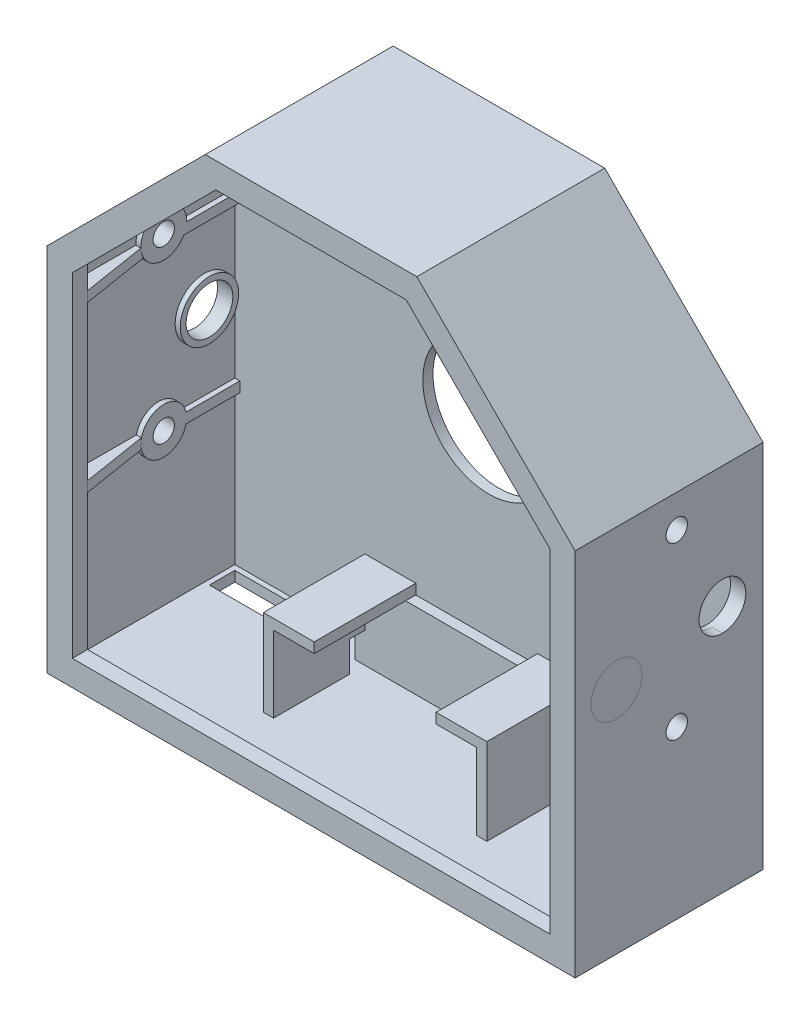
from build123d import *

# Parameters (mm, degrees)
BOSS_EXTRU_1_DEPTH       = 35
COQUE3_T                 = 2
ESQUISSE3_R              = 13
ENL_V_MAT_EXTRU_1_DEPTH  = 82.443231763
ESQUISSE5_W              = 20
ESQUISSE5_H              = 5
ENL_V_MAT_EXTRU_3_DEPTH  = 2
ESQUISSE6_R              = 4.6
ENL_V_MAT_EXTRU_4_DEPTH  = 122.428991596
ESQUISSE7_R              = 2.1
ENL_V_MAT_EXTRU_5_DEPTH  = 122.428991596
ESQUISSE8_W              = 44
ESQUISSE8_H              = 20
BOSS_EXTRU_2_DEPTH       = 17
ESQUISSE9_W              = 40
ESQUISSE9_H              = 15
ENL_V_MAT_EXTRU_7_DEPTH  = 18
ESQUISSE10_W             = 3
ESQUISSE10_H             = 6
ENL_V_MAT_EXTRU_8_DEPTH  = 5
BOSS_EXTRU_4_DEPTH       = 3
ESQUISSE22_R             = 4.5
BOSS_EXTRU_7_DEPTH       = 1
ENL_V_START              = -3
ESQUISSE24_R             = 2.1
ENL_V_MAT_EXTRU_12_DEPTH = 3
ESQUISSE20_R             = 4.5
BOSS_EXTRU_8_DEPTH       = 1
ESQUISSE25_R             = 2.1
ENL_V_MAT_EXTRU_13_DEPTH = 3
BOSS_EXTRU_9_START       = 1
ESQUISSE26_R             = 4.5
BOSS_EXTRU_9_DEPTH       = 1
ESQUISSE27_R             = 2.1
ENL_V_MAT_EXTRU_14_DEPTH = 3
BOSS_EXTRU_10_START      = 1
ESQUISSE28_R             = 4.5
BOSS_EXTRU_10_DEPTH      = 1
ESQUISSE29_R             = 2.1
ENL_V_MAT_EXTRU_15_DEPTH = 3
ESQUISSE34_R             = 5.75
BOSS_EXTRU_16_DEPTH      = 1
ESQUISSE35_R             = 4.6
ENL_V_MAT_EXTRU_19_DEPTH = 1
ESQUISSE36_R             = 5.5
BOSS_EXTRU_17_DEPTH      = 1
ESQUISSE37_R             = 4.6
ENL_V_MAT_EXTRU_20_DEPTH = 1
NERVURE3_REACH           = 96.86
ESQUISSE38_WALL_W        = 204.379203954
ESQUISSE38_WALL_H        = 2
NERVURE4_REACH           = 120.87
ESQUISSE39_WALLS_W       = 252.639353074
ESQUISSE39_WALLS_H       = 2
ESQUISSE40_W             = 24
ESQUISSE40_H             = 20
ENL_V_MAT_EXTRU_21_DEPTH = 2
SYM_TRIE2_START          = 12.2
SYM_TRIE2_OUTLINE_W      = 1
SYM_TRIE2_OUTLINE_H      = 11.067979308
SYM_TRIE2_DEPTH          = 2


with BuildPart() as part:
    # Esquisse1 → Boss.-Extru.1 (new body)
    with BuildSketch(Plane.XY):
        Polygon((-50, 20), (-20, 50), (20, 50), (50, 20), (50, -50), (-50, -50), align=None)
    extrude(amount=BOSS_EXTRU_1_DEPTH)

    # Coque3
    coque3_openings = [part.faces().sort_by_distance(p)[0] for p in [
        (0, -3.956043956, 35),
    ]]
    offset(amount=COQUE3_T, openings=coque3_openings, kind=Kind.INTERSECTION)

    # Esquisse3 → Enlèv. mat.-Extru.1 (cut, through all)
    with BuildSketch(Plane.XY):
        Circle(ESQUISSE3_R)
    extrude(amount=-ENL_V_MAT_EXTRU_1_DEPTH, mode=Mode.SUBTRACT)

    # Esquisse5 → Enlèv. mat.-Extru.3 (cut)
    with BuildSketch(Plane.XZ.offset(52)):
        with Locations((39, 3.5)):
            Rectangle(ESQUISSE5_W, ESQUISSE5_H)
        with Locations((-39, 3.5)):
            Rectangle(ESQUISSE5_W, ESQUISSE5_H)
    extrude(amount=-ENL_V_MAT_EXTRU_3_DEPTH, mode=Mode.SUBTRACT)

    # Esquisse6 → Enlèv. mat.-Extru.4 (cut, through all)
    with BuildSketch(Plane.ZY.offset(52)):
        with Locations(Location((6, -3.111572875, 0), (0, 0, 270))):
            Circle(ESQUISSE6_R)
    extrude(amount=-ENL_V_MAT_EXTRU_4_DEPTH, mode=Mode.SUBTRACT)

    # Esquisse7 → Enlèv. mat.-Extru.5 (cut, through all)
    with BuildSketch(Plane.ZY.offset(52)):
        with Locations(Location((15, 14.388427125, 0), (0, 0, 270))):
            Circle(ESQUISSE7_R)
        with Locations(Location((15, -19.2, 0), (0, 0, 270))):
            Circle(ESQUISSE7_R)
    extrude(amount=-ENL_V_MAT_EXTRU_5_DEPTH, mode=Mode.SUBTRACT)

    # Esquisse8 → Boss.-Extru.2 (add)
    with BuildSketch(Plane(origin=(0, -50, 0), x_dir=(1, 0, 0), z_dir=(0, 1, 0))):
        with Locations((0, -12.381067223)):
            Rectangle(ESQUISSE8_W, ESQUISSE8_H)
    extrude(amount=BOSS_EXTRU_2_DEPTH)

    # Esquisse9 → Enlèv. mat.-Extru.7 (cut)
    with BuildSketch(Plane.XY.offset(22.381067223)):
        with Locations((0, -42.5)):
            Rectangle(ESQUISSE9_W, ESQUISSE9_H)
    extrude(amount=-ENL_V_MAT_EXTRU_7_DEPTH, mode=Mode.SUBTRACT)

    # Esquisse10 → Enlèv. mat.-Extru.8 (cut)
    with BuildSketch(Plane(origin=(-20, 0, 0), x_dir=(0, 0, -1), z_dir=(1, 0, 0))):
        with Locations((-5.881067223, -47)):
            Rectangle(ESQUISSE10_W, ESQUISSE10_H)
    extrude(amount=-ENL_V_MAT_EXTRU_8_DEPTH, mode=Mode.SUBTRACT)

    # Esquisse17 → Boss.-Extru.4 (add)
    with BuildSketch(Plane.XY.offset(35)):
        Polygon((50, -50), (50, 20), (20, 50), (-20, 50), (-50, 20), (-50, -50), align=None)
        Polygon((-47, -47), (47, -47), (47, 18.757359313), (18.757359313, 47), (-18.757359313, 47), (-47, 18.757359313), align=None, mode=Mode.SUBTRACT)
    extrude(amount=-BOSS_EXTRU_4_DEPTH)

    # Esquisse22 → Boss.-Extru.7 (add)
    with BuildSketch(Plane(origin=(-50, 0, 0), x_dir=(0, 0, -1), z_dir=(1, 0, 0))):
        with Locations(Location((-15, -19.2, 0), (0, 0, 90))):
            Circle(ESQUISSE22_R)
    extrude(amount=BOSS_EXTRU_7_DEPTH)

    # Esquisse24 → Enlèv. mat.-Extru.12 (cut)
    with BuildSketch(Plane(origin=(-49, 0, 0), x_dir=(0, 0, -1), z_dir=(1, 0, 0)).offset(ENL_V_START)):
        with Locations(Location((-15, -19.2, 0), (0, 0, 270))):
            Circle(ESQUISSE24_R)
    extrude(amount=ENL_V_MAT_EXTRU_12_DEPTH, mode=Mode.SUBTRACT)

    # Esquisse20 → Boss.-Extru.8 (add)
    with BuildSketch(Plane(origin=(-50, 0, 0), x_dir=(0, 0, -1), z_dir=(1, 0, 0))):
        with Locations(Location((-15, 14.388427125, 0), (0, 0, 90))):
            Circle(ESQUISSE20_R)
    extrude(amount=BOSS_EXTRU_8_DEPTH)

    # Esquisse25 → Enlèv. mat.-Extru.13 (cut)
    with BuildSketch(Plane.ZY.offset(50)):
        with Locations(Location((15, 14.388427125, 0), (0, 0, 270))):
            Circle(ESQUISSE25_R)
    extrude(amount=-ENL_V_MAT_EXTRU_13_DEPTH, mode=Mode.SUBTRACT)

    # Esquisse26 → Boss.-Extru.9 (add)
    with BuildSketch(Plane.ZY.offset(-50).offset(BOSS_EXTRU_9_START)):
        with Locations(Location((15, 14.388427125, 0), (0, 0, 90))):
            Circle(ESQUISSE26_R)
    extrude(amount=-BOSS_EXTRU_9_DEPTH)

    # Esquisse27 → Enlèv. mat.-Extru.14 (cut)
    with BuildSketch(Plane(origin=(50, 0, 0), x_dir=(0, 0, -1), z_dir=(1, 0, 0)).offset(ENL_V_START)):
        with Locations(Location((-15, 14.388427125, 0), (0, 0, 270))):
            Circle(ESQUISSE27_R)
    extrude(amount=ENL_V_MAT_EXTRU_14_DEPTH, mode=Mode.SUBTRACT)

    # Esquisse28 → Boss.-Extru.10 (add)
    with BuildSketch(Plane.ZY.offset(-50).offset(BOSS_EXTRU_10_START)):
        with Locations(Location((15, -19.2, 0), (0, 0, 90))):
            Circle(ESQUISSE28_R)
    extrude(amount=-BOSS_EXTRU_10_DEPTH)

    # Esquisse29 → Enlèv. mat.-Extru.15 (cut)
    with BuildSketch(Plane.ZY.offset(-49)):
        with Locations(Location((15, -19.2, 0), (0, 0, 270))):
            Circle(ESQUISSE29_R)
    extrude(amount=-ENL_V_MAT_EXTRU_15_DEPTH, mode=Mode.SUBTRACT)

    # Esquisse34 → Boss.-Extru.16 (add)
    with BuildSketch(Plane(origin=(-50, 0, 0), x_dir=(0, 0, -1), z_dir=(1, 0, 0))):
        with Locations(Location((-6, -3.111572875, 0), (0, 0, 90))):
            Circle(ESQUISSE34_R)
    extrude(amount=BOSS_EXTRU_16_DEPTH)

    # Esquisse35 → Enlèv. mat.-Extru.19 (cut)
    with BuildSketch(Plane.ZY.offset(50)):
        with Locations(Location((6, -3.111572875, 0), (0, 0, 270))):
            Circle(ESQUISSE35_R)
    extrude(amount=-ENL_V_MAT_EXTRU_19_DEPTH, mode=Mode.SUBTRACT)

    # Esquisse36 → Boss.-Extru.17 (add)
    with BuildSketch(Plane.ZY.offset(-50)):
        with Locations((6, -3.111572875)):
            Circle(ESQUISSE36_R)
    extrude(amount=BOSS_EXTRU_17_DEPTH)

    # Esquisse37 → Enlèv. mat.-Extru.20 (cut)
    with BuildSketch(Plane.ZY.offset(-49)):
        with Locations(Location((6, -3.111572875, 0), (0, 0, 270))):
            Circle(ESQUISSE37_R)
    extrude(amount=-ENL_V_MAT_EXTRU_20_DEPTH, mode=Mode.SUBTRACT)

    # Esquisse38 wall → Nervure3 (add, up to next)
    with BuildSketch(Plane(origin=(-48, -19.2, 25.75), x_dir=(-0.157990501107, 0, -0.987440631917), z_dir=(-0.987440631917, 0, 0.157990501107)), mode=Mode.PRIVATE) as nervure3_sk1:
        Rectangle(ESQUISSE38_WALL_W, ESQUISSE38_WALL_H)
    nervure3_tool1 = extrude(nervure3_sk1.sketch, amount=NERVURE3_REACH, mode=Mode.PRIVATE) - part.part
    nervure3 = nervure3_tool1.solids().sort_by_distance((-48, -19.2, 25.75))[0]
    add(nervure3)

    # Esquisse39 walls → Nervure4 (add, up to next)
    with BuildSketch(Plane(origin=(-49, 0, 0), x_dir=(0, 0, -1), z_dir=(1, 0, 0)), mode=Mode.PRIVATE) as nervure4_sk1:
        with Locations((-6.45, -19.2)):
            Rectangle(ESQUISSE39_WALLS_W, ESQUISSE39_WALLS_H)
    nervure4_tool1 = extrude(nervure4_sk1.sketch, amount=-NERVURE4_REACH, mode=Mode.PRIVATE) - part.part
    nervure4 = nervure4_tool1.solids().sort_by_distance((-49, -19.2, 6.45))[0]
    add(nervure4)

    # Esquisse40 → Enlèv. mat.-Extru.21 (cut)
    with BuildSketch(Plane(origin=(0, -33, 0), x_dir=(1, 0, 0), z_dir=(0, 1, 0))):
        with Locations((0, -12.381067223)):
            Rectangle(ESQUISSE40_W, ESQUISSE40_H)
    extrude(amount=-ENL_V_MAT_EXTRU_21_DEPTH, mode=Mode.SUBTRACT)

    # Symétrie1: Nervure3, Nervure4 across plane
    add(nervure3.mirror(Plane(origin=(0, 0, 0), x_dir=(0, 0, 1), z_dir=(1, 0, 0))))
    add(nervure4.mirror(Plane(origin=(0, 0, 0), x_dir=(0, 0, 1), z_dir=(1, 0, 0))))

    # Symétrie2: read off the stored shape, not the designer's step
    # Symétrie2 outline → Symétrie2 (add)
    with BuildSketch(Plane(origin=(0, 0, 0), x_dir=(1, 0, 0), z_dir=(0, 1, 0)).offset(SYM_TRIE2_START)):
        Polygon((47, -32), (50, -32), (50, -18.932020692), (49.090876689, -18.932020692), align=None)
        with Locations((49.5, -5.533989654)):
            Rectangle(SYM_TRIE2_OUTLINE_W, SYM_TRIE2_OUTLINE_H)
        Polygon((-49.090876689, -18.932020692), (-50, -18.932020692), (-50, -32), (-47, -32), align=None)
        with Locations((-49.5, -5.533989654)):
            Rectangle(SYM_TRIE2_OUTLINE_W, SYM_TRIE2_OUTLINE_H)
    extrude(amount=SYM_TRIE2_DEPTH)


solid = part.part
